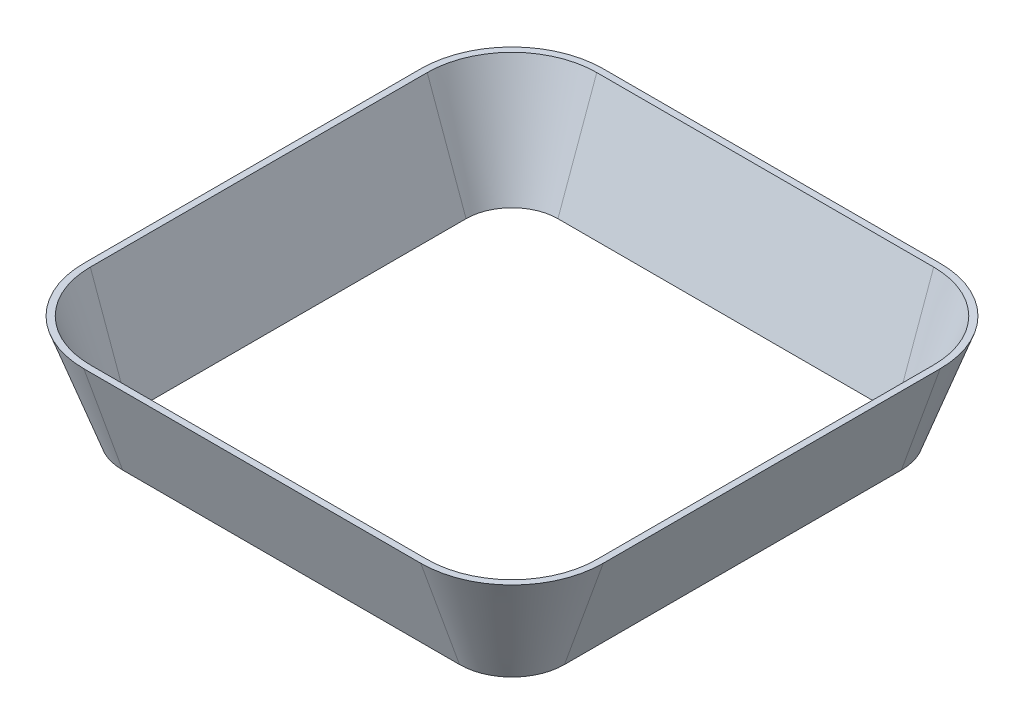
from build123d import *


with BuildPart() as part:
    # Outlet Profile for Hopper Shape → Hopper Shape section 0
    with BuildSketch(Plane(origin=(0, 0, 0), x_dir=(1, 0, 0), z_dir=(0, 1, 0))):
        with BuildLine():
            Line((-55, -72.127068082), (55, -72.127068082))
            # circular arc as an exact rational Bezier (weights 1, cos(half-angle), 1)
            Bezier((55, -72.127068082), (72.127068082, -72.127068082), (72.127068082, -55), weights=[1, 0.707106781, 1])
            Line((72.127068082, -55), (72.127068082, 55))
            Bezier((72.127068082, 55), (72.127068082, 72.127068082), (55, 72.127068082), weights=[1, 0.707106781, 1])
            Line((55, 72.127068082), (-55, 72.127068082))
            Bezier((-55, 72.127068082), (-72.127068082, 72.127068082), (-72.127068082, 55), weights=[1, 0.707106781, 1])
            Line((-72.127068082, 55), (-72.127068082, -55))
            Bezier((-72.127068082, -55), (-72.127068082, -72.127068082), (-55, -72.127068082), weights=[1, 0.707106781, 1])
        make_face()
    # Inlet Profile for Hopper Shape → Hopper Shape section 1
    with BuildSketch(Plane(origin=(0, 35, 0), x_dir=(1, 0, 0), z_dir=(0, 1, 0))):
        with BuildLine():
            Line((-55, -84.8), (55, -84.8))
            Bezier((55, -84.8), (84.8, -84.8), (84.8, -55), weights=[1, 0.707106781, 1])
            Line((84.8, -55), (84.8, 55))
            Bezier((84.8, 55), (84.8, 84.8), (55, 84.8), weights=[1, 0.707106781, 1])
            Line((55, 84.8), (-55, 84.8))
            Bezier((-55, 84.8), (-84.8, 84.8), (-84.8, 55), weights=[1, 0.707106781, 1])
            Line((-84.8, 55), (-84.8, -55))
            Bezier((-84.8, -55), (-84.8, -84.8), (-55, -84.8), weights=[1, 0.707106781, 1])
        make_face()
    loft()

    # Wall Thickness: read off the stored shape, not the designer's step
    # Wall Thickness: loft between two sections, ruled curve by curve
    wall_thickness_from = [
        Edge.make_three_point_arc((-55, 0, -70), (-65.606601718, 0, -65.606601718), (-70, 0, -55)),
        Edge.make_three_point_arc((-70, 0, 55), (-65.606601718, 0, 65.606601718), (-55, 0, 70)),
        Edge.make_three_point_arc((55, 0, 70), (65.606601718, 0, 65.606601718), (70, 0, 55)),
        Edge.make_three_point_arc((70, 0, -55), (65.606601718, 0, -65.606601718), (55, 0, -70)),
        Edge.make_line((-55, 0, -70), (55, 0, -70)),
        Edge.make_line((-70, 0, 55), (-70, 0, -55)),
        Edge.make_line((55, 0, 70), (-55, 0, 70)),
        Edge.make_line((70, 0, -55), (70, 0, 55)),
    ]
    wall_thickness_to = [
        Edge.make_three_point_arc((-55, 35, -82.672931918), (-74.567717815, 35, -74.567717815), (-82.672931918, 35, -55)),
        Edge.make_three_point_arc((-82.672931918, 35, 55), (-74.567717815, 35, 74.567717815), (-55, 35, 82.672931918)),
        Edge.make_three_point_arc((55, 35, 82.672931918), (74.567717815, 35, 74.567717815), (82.672931918, 35, 55)),
        Edge.make_three_point_arc((82.672931918, 35, -55), (74.567717815, 35, -74.567717815), (55, 35, -82.672931918)),
        Edge.make_line((-55, 35, -82.672931918), (55, 35, -82.672931918)),
        Edge.make_line((-82.672931918, 35, 55), (-82.672931918, 35, -55)),
        Edge.make_line((55, 35, 82.672931918), (-55, 35, 82.672931918)),
        Edge.make_line((82.672931918, 35, -55), (82.672931918, 35, 55)),
    ]
    wall_thickness = Solid(Shell([*[Face.make_surface_from_curves(wall_thickness_from[k], wall_thickness_to[k]) for k in range(8)], Face(Wire(wall_thickness_from)), Face(Wire(wall_thickness_to))]))
    add(wall_thickness, mode=Mode.SUBTRACT)


solid = part.part
